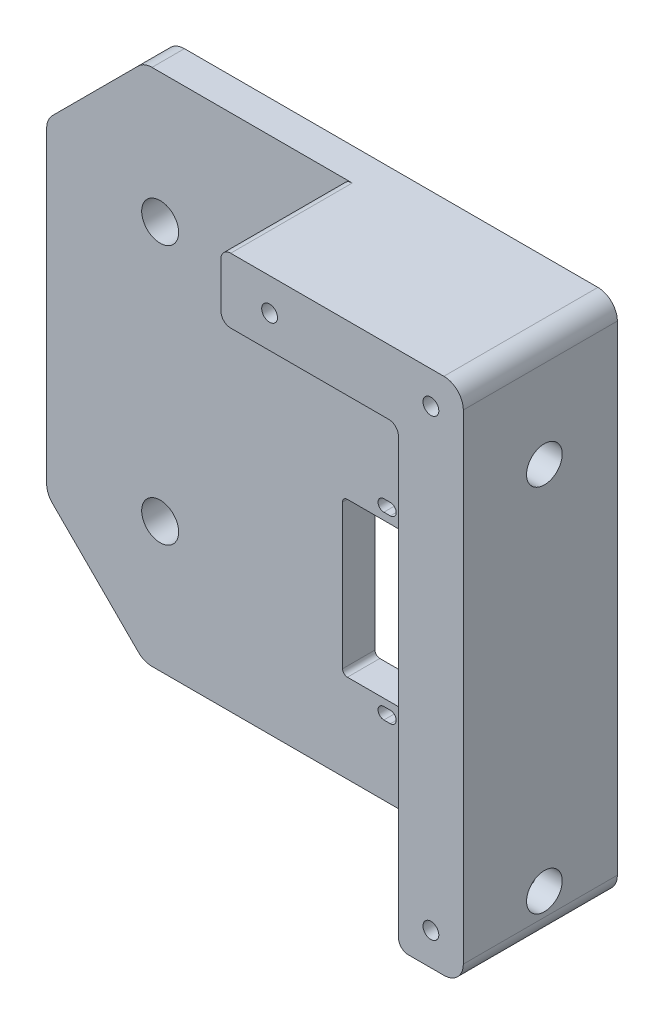
from build123d import *

# Parameters (mm, degrees)
BASE_W                 = 13.75
BASE_H                 = 23.75
MAIN_DEPTH             = 5
GEAR_AXIS_HOLES_D      = 5.7
M1_6_CLEARANCE_HOLE1_D = 1.8
BOSS_EXTRUDE1_DEPTH    = 18.75
FILLET2_R              = 0.75
FILLET4_R              = 1.5
CHAMFER1_SIZE          = 15
FILLET6_R              = 3
CUT_EXTRUDE1_DEPTH     = 62.805259158
F_2_CLEARANCE_HOLE1_D  = 2.4384
M5_CLEARANCE_HOLE1_D   = 5.5


with BuildPart() as part:
    # Base → Main (new body)
    with BuildSketch(Plane.XY):
        Polygon((43.224154817, 40), (-39.775845183, 40), (-39.775845183, -40), (-17.775845183, -40), (43.224154817, -40), align=None)
        with Locations((12.724154817, -14.495)):
            Rectangle(BASE_W, BASE_H, mode=Mode.SUBTRACT)
    extrude(amount=MAIN_DEPTH)

    # Gear Axis Holes (through all)
    with Locations(Plane(origin=(0, 0, 5), x_dir=(-1, 0, 0), z_dir=(0, 0, 1))):
        with Locations((22.275845183, 20), (22.275845183, -20)):
            Hole(GEAR_AXIS_HOLES_D / 2)

    # M1.6 Clearance Hole1 (through all)
    with Locations(Plane.XY.offset(5)):
        with Locations((12.724154817, -0.62), (12.724154817, -28.37)):
            Hole(M1_6_CLEARANCE_HOLE1_D / 2)

    # Sketch13 → Boss-Extrude1 (add)
    with BuildSketch(Plane.XY.offset(5)):
        Polygon((5.849154817, 30), (33.224154817, 30), (33.224154817, 1), (33.224154817, -30), (33.224154817, -40), (43.224154817, -40), (43.224154817, 1), (43.224154817, 40), (5.849154817, 40), align=None)
    extrude(amount=BOSS_EXTRUDE1_DEPTH)

    # Fillet2
    fillet2_edges = [part.edges().sort_by_distance(p)[0] for p in [
        (19.599154817, -26.37, 2.5),
        (5.849154817, -26.37, 2.5),
        (19.599154817, -2.62, 2.5),
        (5.849154817, -2.62, 2.5),
    ]]
    fillet(fillet2_edges, radius=FILLET2_R)

    # Fillet4
    fillet4_edges = [part.edges().sort_by_distance(p)[0] for p in [
        (5.849154817, 40, 14.375),
        (5.849154817, 30, 14.375),
        (33.224154817, 30, 14.375),
        (33.224154817, -40, 14.375),
    ]]
    fillet(fillet4_edges, radius=FILLET4_R)

    # Chamfer1
    chamfer1_edges = [part.edges().sort_by_distance(p)[0] for p in [
        (-39.775845183, -40, 2.5),
        (-39.775845183, 40, 2.5),
    ]]
    chamfer(chamfer1_edges, length=CHAMFER1_SIZE)

    # Fillet6
    fillet6_edges = [part.edges().sort_by_distance(p)[0] for p in [
        (-24.775845183, -40, 2.5),
        (-39.775845183, -25, 2.5),
        (-39.775845183, 25, 2.5),
        (-24.775845183, 40, 2.5),
        (43.224154817, 40, 11.875),
        (43.224154817, -40, 11.875),
    ]]
    fillet(fillet6_edges, radius=FILLET6_R)

    # Sketch14 → Cut-Extrude1 (cut, through all)
    with BuildSketch(Plane.XY.offset(5)):
        with BuildLine():
            Line((12.224154817, 0.28), (13.224154817, 0.28))
            ThreePointArc((13.224154817, 0.28), (14.124154817, -0.62), (13.224154817, -1.52))
            Line((13.224154817, -1.52), (12.224154817, -1.52))
            ThreePointArc((12.224154817, -1.52), (11.324154817, -0.62), (12.224154817, 0.28))
        make_face()
        with BuildLine():
            Line((12.224154817, -27.47), (13.224154817, -27.47))
            ThreePointArc((13.224154817, -27.47), (14.124154817, -28.37), (13.224154817, -29.27))
            Line((13.224154817, -29.27), (12.224154817, -29.27))
            ThreePointArc((12.224154817, -29.27), (11.324154817, -28.37), (12.224154817, -27.47))
        make_face()
    extrude(amount=-CUT_EXTRUDE1_DEPTH, mode=Mode.SUBTRACT)

    # #2 Clearance Hole1 (through all)
    with Locations(Plane.XY.offset(23.75)):
        with Locations((13.349154817, 35), (38.224154817, 35), (38.224154817, -35)):
            Hole(F_2_CLEARANCE_HOLE1_D / 2)

    # M5 Clearance Hole1 (through all)
    with Locations(Plane.ZY.offset(-33.224154817)):
        with Locations((11.25, 23.5), (11.25, -33.5)):
            Hole(M5_CLEARANCE_HOLE1_D / 2)


solid = part.part
